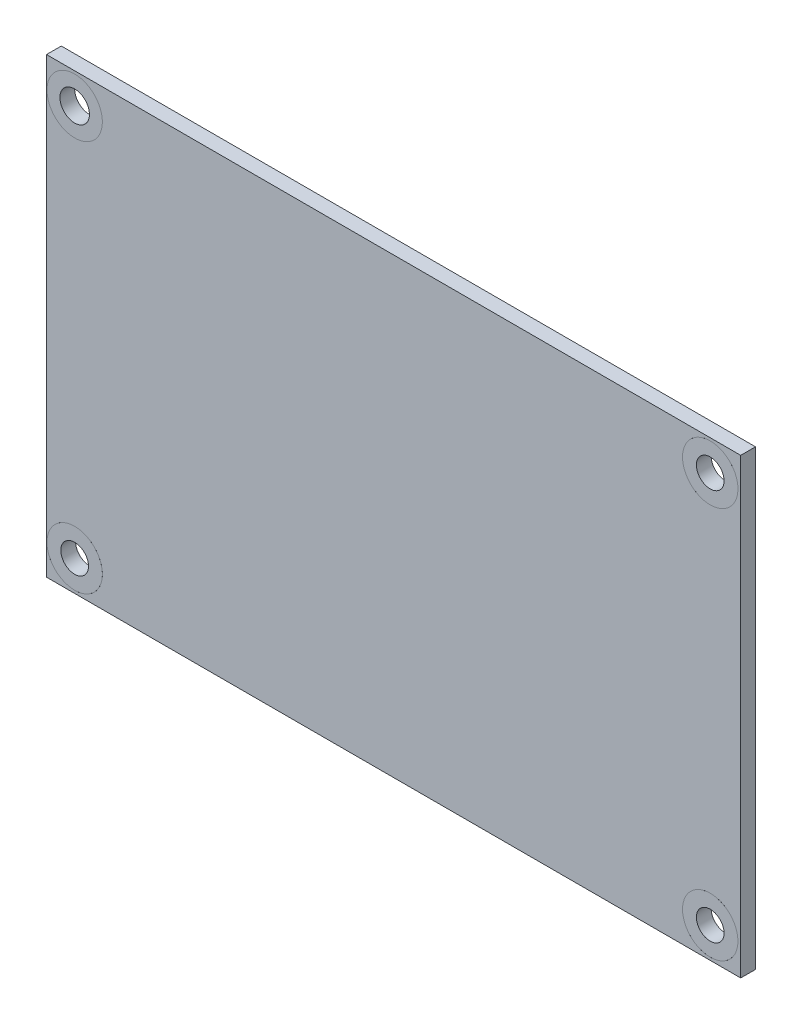
from build123d import *

# Parameters (mm, degrees)
CUT_EXTRUDE1_START       = -1.6002
CUT_EXTRUDE1_OUTLINE_W   = 75.18
CUT_EXTRUDE1_OUTLINE_H   = 49.02
CUT_EXTRUDE1_OUTLINE_R   = 1.6
CUT_EXTRUDE1_OUTLINE_R_2 = 3
CUT_EXTRUDE1_DEPTH       = 1.6002
SKETCH3_R                = 3
SKETCH3_R_2              = 1.6
BOSS_EXTRUDE2_DEPTH      = 1.6002
SKETCH4_R                = 3
CUT_EXTRUDE2_DEPTH       = 45.903327717
SKETCH7_R                = 3
SKETCH7_R_2              = 1.5
BOSS_EXTRUDE4_DEPTH      = 1.6002
SKETCH8_R                = 3
SKETCH8_R_2              = 1.5
BOSS_EXTRUDE5_DEPTH      = 1.6002
SKETCH9_R                = 3
SKETCH9_R_2              = 1.5
BOSS_EXTRUDE6_DEPTH      = 1.6002


with BuildPart() as part:
    # Cut-Extrude1: read off the stored shape, not the designer's step
    # Cut-Extrude1 outline → Cut-Extrude1 (new body)
    with BuildSketch(Plane.XY.offset(1.6002).offset(CUT_EXTRUDE1_START)):
        Rectangle(CUT_EXTRUDE1_OUTLINE_W, CUT_EXTRUDE1_OUTLINE_H)
        with Locations((-34.54, -21.21)):
            Circle(CUT_EXTRUDE1_OUTLINE_R, mode=Mode.SUBTRACT)
        with Locations((34.29, -21.21)):
            Circle(CUT_EXTRUDE1_OUTLINE_R, mode=Mode.SUBTRACT)
        with Locations((-34.54, 21.21)):
            Circle(CUT_EXTRUDE1_OUTLINE_R_2, mode=Mode.SUBTRACT)
        with Locations((34.29, 21.21)):
            Circle(CUT_EXTRUDE1_OUTLINE_R, mode=Mode.SUBTRACT)
    extrude(amount=CUT_EXTRUDE1_DEPTH)

    # Sketch4 → Cut-Extrude2 (cut, through all)
    with BuildSketch(Plane(origin=(0, 0, 0), x_dir=(-1, 0, 0), z_dir=(0, 0, -1))):
        with Locations((34.54, -21.21)):
            Circle(SKETCH4_R)
        with Locations((-34.29, -21.21)):
            Circle(SKETCH4_R)
        with Locations((-34.29, 21.21)):
            Circle(SKETCH4_R)
    extrude(amount=-CUT_EXTRUDE2_DEPTH, mode=Mode.SUBTRACT)


with BuildPart() as body_2:
    # Sketch3 → Boss-Extrude2 (new body)
    with BuildSketch(Plane.XY.offset(1.6002)):
        with Locations((-34.54, 21.21)):
            Circle(SKETCH3_R)
        with Locations((-34.54, 21.21)):
            Circle(SKETCH3_R_2, mode=Mode.SUBTRACT)
    extrude(amount=-BOSS_EXTRUDE2_DEPTH)


with BuildPart() as body_3:
    # Sketch7 → Boss-Extrude4 (new body)
    with BuildSketch(Plane(origin=(0, 0, 0), x_dir=(-1, 0, 0), z_dir=(0, 0, -1))):
        with Locations((-34.29, 21.21)):
            Circle(SKETCH7_R)
        with Locations((-34.29, 21.21)):
            Circle(SKETCH7_R_2, mode=Mode.SUBTRACT)
    extrude(amount=-BOSS_EXTRUDE4_DEPTH)


with BuildPart() as body_4:
    # Sketch8 → Boss-Extrude5 (new body)
    with BuildSketch(Plane(origin=(0, 0, 0), x_dir=(-1, 0, 0), z_dir=(0, 0, -1))):
        with Locations((-34.29, -21.21)):
            Circle(SKETCH8_R)
        with Locations((-34.29, -21.21)):
            Circle(SKETCH8_R_2, mode=Mode.SUBTRACT)
    extrude(amount=-BOSS_EXTRUDE5_DEPTH)


with BuildPart() as body_5:
    # Sketch9 → Boss-Extrude6 (new body)
    with BuildSketch(Plane(origin=(0, 0, 0), x_dir=(-1, 0, 0), z_dir=(0, 0, -1))):
        with Locations((34.54, -21.21)):
            Circle(SKETCH9_R)
        with Locations((34.54, -21.21)):
            Circle(SKETCH9_R_2, mode=Mode.SUBTRACT)
    extrude(amount=-BOSS_EXTRUDE6_DEPTH)


solid = Compound([part.part, body_2.part, body_3.part, body_4.part, body_5.part])
